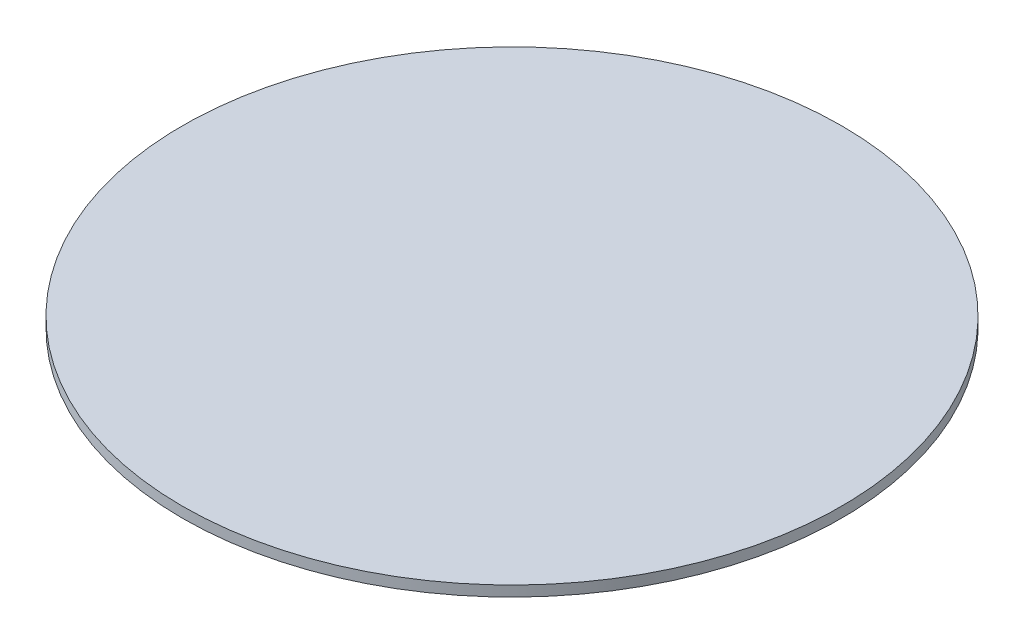
from build123d import *

# Parameters (mm, degrees)
SKETCH1_R           = 100
BOSS_EXTRUDE1_DEPTH = 3.175


with BuildPart() as part:
    # Sketch1 → Boss-Extrude1 (new body)
    with BuildSketch(Plane(origin=(0, 0, 0), x_dir=(1, 0, 0), z_dir=(0, 1, 0))):
        Circle(SKETCH1_R)
    extrude(amount=BOSS_EXTRUDE1_DEPTH)


solid = part.part
